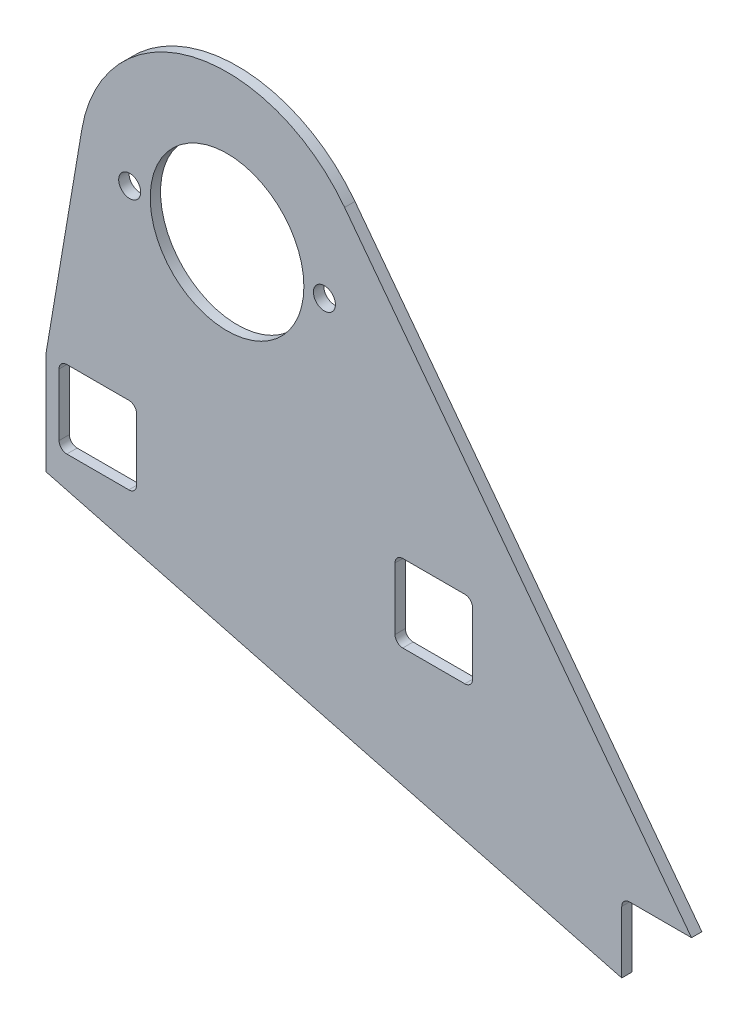
from build123d import *

# Parameters (mm, degrees)
SKETCH_1_R             = 4.25
SKETCH_1_R_2           = 29.732137495
SM_BASE_FLANGE_1_DEPTH = 4


# Sheet-metal steps are written as plain solids
with BuildPart() as part:
    # Sketch 1 → Базовая кромка1 (new body)
    with BuildSketch(Plane.XY):
        with BuildLine():
            Line((179.733197448, -143.22618932), (45.492707493, 34.38406884))
            ThreePointArc((45.492707493, 34.38406884), (-13.549825845, 55.391812072), (-56.227876086, 9.501398625))
            Line((-56.227876086, 9.501398625), (-70, -72))
            Line((-70, -72), (-70, -112))
            Line((-70, -112), (152.733197448, -170.22618932))
            Line((152.733197448, -170.22618932), (152.733197448, -146.22618932))
            ThreePointArc((152.733197448, -146.22618932), (153.611877105, -144.104868976), (155.733197448, -143.22618932))
            Line((155.733197448, -143.22618932), (179.733197448, -143.22618932))
        make_face()
        with Locations((-37.675, 0)):
            Circle(SKETCH_1_R, mode=Mode.SUBTRACT)
        Circle(SKETCH_1_R_2, mode=Mode.SUBTRACT)
        with Locations((37.675, 0)):
            Circle(SKETCH_1_R, mode=Mode.SUBTRACT)
        with BuildLine():
            Line((-62, -102), (-38, -102))
            ThreePointArc((-38, -102), (-35.878679656, -101.121320344), (-35, -99))
            Line((-35, -99), (-35, -75))
            ThreePointArc((-35, -75), (-35.878679656, -72.878679656), (-38, -72))
            Line((-38, -72), (-62, -72))
            ThreePointArc((-62, -72), (-64.121320344, -72.878679656), (-65, -75))
            Line((-65, -75), (-65, -99))
            ThreePointArc((-65, -99), (-64.121320344, -101.121320344), (-62, -102))
        make_face(mode=Mode.SUBTRACT)
        with BuildLine():
            Line((68, -102), (92, -102))
            ThreePointArc((92, -102), (94.121320344, -101.121320344), (95, -99))
            Line((95, -99), (95, -75))
            ThreePointArc((95, -75), (94.121320344, -72.878679656), (92, -72))
            Line((92, -72), (68, -72))
            ThreePointArc((68, -72), (65.878679656, -72.878679656), (65, -75))
            Line((65, -75), (65, -99))
            ThreePointArc((65, -99), (65.878679656, -101.121320344), (68, -102))
        make_face(mode=Mode.SUBTRACT)
    extrude(amount=-SM_BASE_FLANGE_1_DEPTH)


solid = part.part
